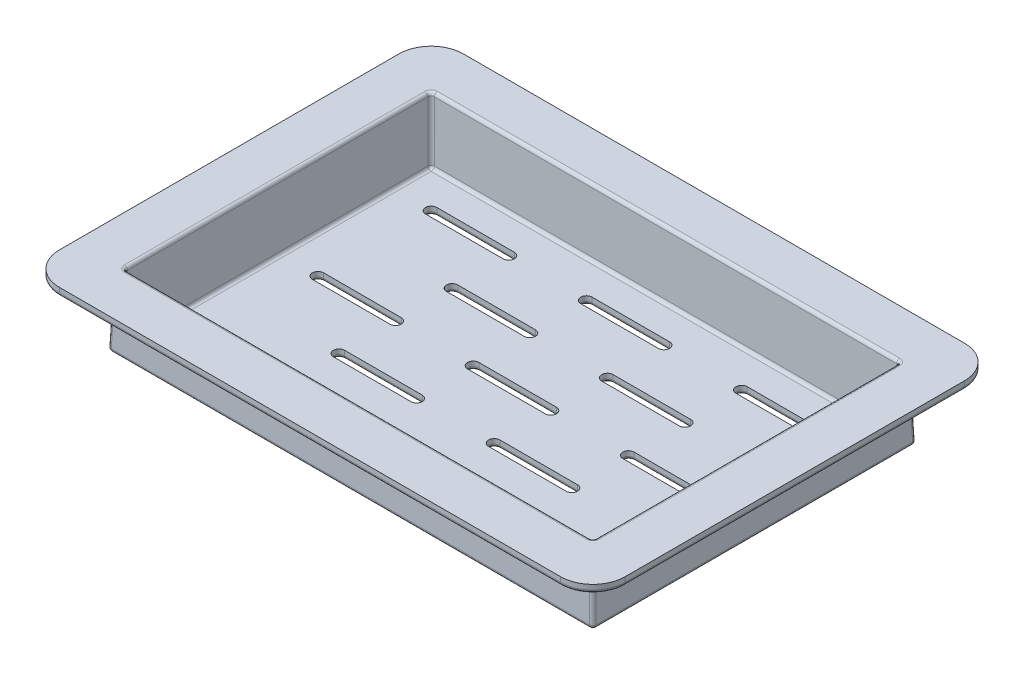
from build123d import *

# Parameters (mm, degrees)
SKETCH19_W          = 175
SKETCH19_H          = 125
BOSS_EXTRUDE4_DEPTH = 22
SKETCH20_W          = 145
SKETCH20_H          = 95
CUT_EXTRUDE4_DEPTH  = 19.5
CUT_EXTRUDE4_DRAFT  = -3
SKETCH21_W          = 175
SKETCH21_H          = 125
SKETCH21_W_2        = 151
SKETCH21_H_2        = 101
CUT_EXTRUDE5_DEPTH  = 19.5
SKETCH26_W          = 151
SKETCH26_H          = 101
SKETCH26_W_2        = 150
SKETCH26_H_2        = 100
CUT_EXTRUDE10_DEPTH = 19.5
CUT_EXTRUDE10_DRAFT = 2
FILLET2_R           = 1
FILLET3_R           = 10
CUT_EXTRUDE11_DEPTH = 19.5
FILLET4_R           = 1


with BuildPart() as part:
    # Sketch19 → Boss-Extrude4 (new body)
    with BuildSketch(Plane(origin=(0, 0, 0), x_dir=(1, 0, 0), z_dir=(0, 1, 0))):
        Rectangle(SKETCH19_W, SKETCH19_H)
    extrude(amount=-BOSS_EXTRUDE4_DEPTH)


with BuildPart() as cut_extrude4_tool:
    # Sketch20 → Cut-Extrude4 (with draft: the straight prism first)
    with BuildSketch(Plane(origin=(0, 0, 0), x_dir=(1, 0, 0), z_dir=(0, 1, 0))):
        Rectangle(SKETCH20_W, SKETCH20_H)
    extrude(amount=-CUT_EXTRUDE4_DEPTH)
    # Cut-Extrude4: the draft: its side faces are tilted about the plane it starts from
    cut_extrude4_sides = [cut_extrude4_tool.faces().sort_by_distance(p)[0] for p in [
        (72.5, -9.75, 0),
        (0, -9.75, -47.5),
        (-72.5, -9.75, 0),
        (0, -9.75, 47.5),
    ]]
    draft(cut_extrude4_sides, Plane(origin=(0, 0, 0), x_dir=(1, 0, 0), z_dir=(0, 1, 0)), CUT_EXTRUDE4_DRAFT)


with BuildPart() as part_1:
    add(part.part)

    # Cut-Extrude4: cut by cut_extrude4_tool
    add(cut_extrude4_tool.part, mode=Mode.SUBTRACT)

    # Sketch21 → Cut-Extrude5 (cut)
    with BuildSketch(Plane.XZ.offset(22)):
        Rectangle(SKETCH21_W, SKETCH21_H)
        Rectangle(SKETCH21_W_2, SKETCH21_H_2, mode=Mode.SUBTRACT)
    extrude(amount=-CUT_EXTRUDE5_DEPTH, mode=Mode.SUBTRACT)


with BuildPart() as cut_extrude10_tool:
    # Sketch26 → Cut-Extrude10 (with draft: the straight prism first)
    with BuildSketch(Plane.XZ.offset(22)):
        Rectangle(SKETCH26_W, SKETCH26_H)
        Rectangle(SKETCH26_W_2, SKETCH26_H_2, mode=Mode.SUBTRACT)
    extrude(amount=-CUT_EXTRUDE10_DEPTH)
    # Cut-Extrude10: the draft: its side faces are tilted about the plane it starts from
    cut_extrude10_sides = [cut_extrude10_tool.faces().sort_by_distance(p)[0] for p in [
        (0, -12.25, -50.5),
        (75.5, -12.25, 0),
        (0, -12.25, 50.5),
        (-75.5, -12.25, 0),
        (0, -12.25, 50),
        (75, -12.25, 0),
        (0, -12.25, -50),
        (-75, -12.25, 0),
    ]]
    draft(cut_extrude10_sides, Plane.XZ.offset(22), CUT_EXTRUDE10_DRAFT)


with BuildPart() as part_2:
    add(part_1.part)

    # Cut-Extrude10: cut by cut_extrude10_tool
    add(cut_extrude10_tool.part, mode=Mode.SUBTRACT)

    # Fillet2
    fillet2_edges = [part_2.edges().sort_by_distance(p)[0] for p in [
        (-71.478048304, -19.5, 0),
        (-71.989024152, -9.75, 46.989024152),
        (0, -19.5, -46.478048304),
        (-71.989024152, -9.75, -46.989024152),
        (71.478048304, -19.5, 0),
        (71.989024152, -9.75, -46.989024152),
        (0, -19.5, 46.478048304),
        (71.989024152, -9.75, 46.989024152),
        (-72.5, 0, 0),
        (0, 0, 47.5),
        (72.5, 0, 0),
        (0, 0, -47.5),
        (-87.5, -2.5, 0),
        (0, -2.5, 62.5),
        (87.5, -2.5, 0),
        (0, -2.5, -62.5),
        (74.319044995, -2.5, 0),
        (0, -2.5, 49.319044995),
        (-74.319044995, -2.5, 0),
        (0, -2.5, -49.319044995),
        (0, -22, 50),
        (74.659522497, -12.25, 49.659522497),
        (75, -22, 0),
        (74.659522497, -12.25, -49.659522497),
        (0, -22, -50),
        (-74.659522497, -12.25, -49.659522497),
        (-75, -22, 0),
        (-74.659522497, -12.25, 49.659522497),
    ]]
    fillet(fillet2_edges, radius=FILLET2_R)

    # Fillet3
    # the kernel refuses this fillet: 10 mm, written as the material it takes off along each edge
    with BuildSketch(Plane(origin=(77.5, -2.5, -52.5), x_dir=(0, 0, -1), z_dir=(-1, 0, 0))) as fillet3_piece_1:
        with BuildLine():
            CenterArc((9, -1), 1, 0, 90)
            Line((10, -1), (10, 0))
            Line((10, 0), (9, 0))
        make_face()
    revolve(axis=Axis((77.5, -2.5, -52.5), (0, -1, 0)), revolution_arc=90, mode=Mode.SUBTRACT)
    with BuildSketch(Plane(origin=(-77.5, -2.5, -52.5), x_dir=(-1, 0, 0), z_dir=(0, 0, 1))) as fillet3_piece_2:
        with BuildLine():
            CenterArc((9, -1), 1, 0, 90)
            Line((10, -1), (10, 0))
            Line((10, 0), (9, 0))
        make_face()
    revolve(axis=Axis((-77.5, -2.5, -52.5), (0, -1, 0)), revolution_arc=90, mode=Mode.SUBTRACT)
    with BuildSketch(Plane(origin=(77.5, -2.5, 52.5), x_dir=(1, 0, 0), z_dir=(0, 0, -1))) as fillet3_piece_3:
        with BuildLine():
            CenterArc((9, -1), 1, 0, 90)
            Line((10, -1), (10, 0))
            Line((10, 0), (9, 0))
        make_face()
    revolve(axis=Axis((77.5, -2.5, 52.5), (0, -1, 0)), revolution_arc=90, mode=Mode.SUBTRACT)
    with BuildSketch(Plane(origin=(-77.5, -2.5, 52.5), x_dir=(0, 0, 1), z_dir=(1, 0, 0))) as fillet3_piece_4:
        with BuildLine():
            CenterArc((9, -1), 1, 0, 90)
            Line((10, -1), (10, 0))
            Line((10, 0), (9, 0))
        make_face()
    revolve(axis=Axis((-77.5, -2.5, 52.5), (0, -1, 0)), revolution_arc=90, mode=Mode.SUBTRACT)
    with BuildSketch(Plane(origin=(-87.5, 25, 62.5), x_dir=(1, 0, 0), z_dir=(0, -1, 0)), Plane(origin=(-87.5, 25, -62.5), x_dir=(0, 0, 1), z_dir=(0, -1, 0))) as fillet3_piece_5:
        with BuildLine():
            CenterArc((FILLET3_R, -FILLET3_R), FILLET3_R, 90, 90)
            Line((0, -FILLET3_R), (0, 0))
            Line((0, 0), (FILLET3_R, 0))
        make_face()
    extrude(amount=27.5, mode=Mode.SUBTRACT)
    with BuildSketch(Plane(origin=(87.5, 25, 62.5), x_dir=(-1, 0, 0), z_dir=(0, -1, 0)), Plane(origin=(87.5, 25, -62.5), x_dir=(0, 0, 1), z_dir=(0, -1, 0))) as fillet3_piece_6:
        with BuildLine():
            CenterArc((FILLET3_R, FILLET3_R), FILLET3_R, 180, 90)
            Line((0, FILLET3_R), (0, 0))
            Line((0, 0), (FILLET3_R, 0))
        make_face()
    extrude(amount=27.5, mode=Mode.SUBTRACT)

    # Sketch27 → Cut-Extrude11 (cut)
    with BuildSketch(Plane.XZ.offset(22)):
        with BuildLine():
            Line((-12, 1.75), (12, 1.75))
            ThreePointArc((12, 1.75), (13.75, 0), (12, -1.75))
            Line((12, -1.75), (-12, -1.75))
            ThreePointArc((-12, -1.75), (-13.75, 0), (-12, 1.75))
        make_face()
        with BuildLine():
            Line((36, 1.75), (60, 1.75))
            ThreePointArc((60, 1.75), (61.75, 0), (60, -1.75))
            Line((60, -1.75), (36, -1.75))
            ThreePointArc((36, -1.75), (34.25, 0), (36, 1.75))
        make_face()
        with BuildLine():
            Line((-60, 1.75), (-36, 1.75))
            ThreePointArc((-36, 1.75), (-34.25, 0), (-36, -1.75))
            Line((-36, -1.75), (-60, -1.75))
            ThreePointArc((-60, -1.75), (-61.75, 0), (-60, 1.75))
        make_face()
        with BuildLine():
            Line((-36, 19.25), (-12, 19.25))
            ThreePointArc((-12, 19.25), (-10.25, 17.5), (-12, 15.75))
            Line((-12, 15.75), (-36, 15.75))
            ThreePointArc((-36, 15.75), (-37.75, 17.5), (-36, 19.25))
        make_face()
        with BuildLine():
            Line((12, 19.25), (36, 19.25))
            ThreePointArc((36, 19.25), (37.75, 17.5), (36, 15.75))
            Line((36, 15.75), (12, 15.75))
            ThreePointArc((12, 15.75), (10.25, 17.5), (12, 19.25))
        make_face()
        with BuildLine():
            Line((12, 33.25), (-12, 33.25))
            ThreePointArc((-12, 33.25), (-13.75, 35), (-12, 36.75))
            Line((-12, 36.75), (12, 36.75))
            ThreePointArc((12, 36.75), (13.75, 35), (12, 33.25))
        make_face()
        with BuildLine():
            Line((12, -33.25), (-12, -33.25))
            ThreePointArc((-12, -33.25), (-13.75, -35), (-12, -36.75))
            Line((-12, -36.75), (12, -36.75))
            ThreePointArc((12, -36.75), (13.75, -35), (12, -33.25))
        make_face()
        with BuildLine():
            Line((12, -19.25), (36, -19.25))
            ThreePointArc((36, -19.25), (37.75, -17.5), (36, -15.75))
            Line((36, -15.75), (12, -15.75))
            ThreePointArc((12, -15.75), (10.25, -17.5), (12, -19.25))
        make_face()
        with BuildLine():
            Line((-36, -19.25), (-12, -19.25))
            ThreePointArc((-12, -19.25), (-10.25, -17.5), (-12, -15.75))
            Line((-12, -15.75), (-36, -15.75))
            ThreePointArc((-36, -15.75), (-37.75, -17.5), (-36, -19.25))
        make_face()
        with BuildLine():
            Line((36, -36.75), (60, -36.75))
            ThreePointArc((60, -36.75), (61.75, -35), (60, -33.25))
            Line((60, -33.25), (36, -33.25))
            ThreePointArc((36, -33.25), (34.25, -35), (36, -36.75))
        make_face()
        with BuildLine():
            Line((-60, -36.75), (-36, -36.75))
            ThreePointArc((-36, -36.75), (-34.25, -35), (-36, -33.25))
            Line((-36, -33.25), (-60, -33.25))
            ThreePointArc((-60, -33.25), (-61.75, -35), (-60, -36.75))
        make_face()
        with BuildLine():
            Line((-60, 33.25), (-36, 33.25))
            ThreePointArc((-36, 33.25), (-34.25, 35), (-36, 36.75))
            Line((-36, 36.75), (-60, 36.75))
            ThreePointArc((-60, 36.75), (-61.75, 35), (-60, 33.25))
        make_face()
        with BuildLine():
            Line((36, 33.25), (60, 33.25))
            ThreePointArc((60, 33.25), (61.75, 35), (60, 36.75))
            Line((60, 36.75), (36, 36.75))
            ThreePointArc((36, 36.75), (34.25, 35), (36, 33.25))
        make_face()
    extrude(amount=-CUT_EXTRUDE11_DEPTH, mode=Mode.SUBTRACT)

    # Fillet4
    fillet4_edges = [part_2.edges().sort_by_distance(p)[0] for p in [
        (13.75, -22, 35),
        (0, -22, 36.75),
        (-13.75, -22, 35),
        (0, -22, 33.25),
        (13.75, -22, -35),
        (0, -22, -33.25),
        (-13.75, -22, -35),
        (0, -22, -36.75),
        (10.25, -22, -17.5),
        (24, -22, -19.25),
        (37.75, -22, -17.5),
        (24, -22, -15.75),
        (-37.75, -22, -17.5),
        (-24, -22, -19.25),
        (-10.25, -22, -17.5),
        (-24, -22, -15.75),
        (10.25, -22, 17.5),
        (24, -22, 15.75),
        (37.75, -22, 17.5),
        (24, -22, 19.25),
        (-37.75, -22, 17.5),
        (-24, -22, 15.75),
        (-10.25, -22, 17.5),
        (-24, -22, 19.25),
        (-61.75, -22, 0),
        (-48, -22, -1.75),
        (-34.25, -22, 0),
        (-48, -22, 1.75),
        (34.25, -22, 0),
        (48, -22, -1.75),
        (61.75, -22, 0),
        (48, -22, 1.75),
        (34.25, -22, -35),
        (48, -22, -36.75),
        (61.75, -22, -35),
        (48, -22, -33.25),
        (-61.75, -22, -35),
        (-48, -22, -36.75),
        (-34.25, -22, -35),
        (-48, -22, -33.25),
        (-61.75, -22, 35),
        (-48, -22, 33.25),
        (-34.25, -22, 35),
        (-48, -22, 36.75),
        (34.25, -22, 35),
        (48, -22, 33.25),
        (61.75, -22, 35),
        (48, -22, 36.75),
        (-13.75, -22, 0),
        (0, -22, -1.75),
        (13.75, -22, 0),
        (0, -22, 1.75),
    ]]
    fillet(fillet4_edges, radius=FILLET4_R)


solid = part_2.part
